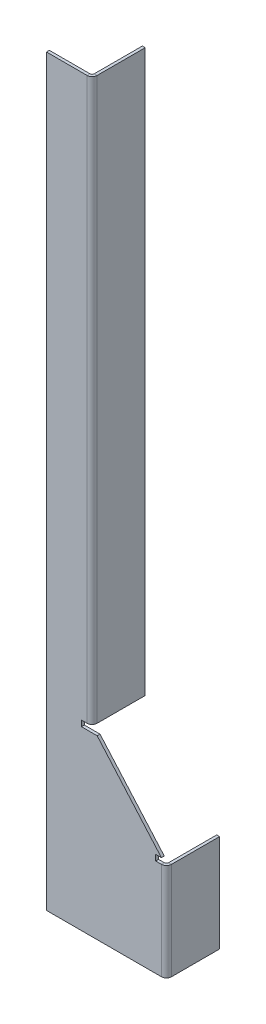
from build123d import *

# Parameters (mm, degrees)
BASE_FLANGE1_DEPTH              = 2.7
EDGE_FLANGE1_STRIP_W            = 14.8
EDGE_FLANGE1_STRIP_H            = 2.7
EDGE_FLANGE1_STRIP_CUT_DEPTH    = 91.7
EDGE_FLANGE1_RELIEF_W           = 20.2
EDGE_FLANGE1_RELIEF_H           = 5.4
EDGE_FLANGE1_RELIEF_CUT_DEPTH   = 2.7
EDGE_FLANGE1_STRIP_2_W          = 14.8
EDGE_FLANGE1_STRIP_2_H          = 2.7
EDGE_FLANGE1_STRIP_CUT_2_DEPTH  = 528.3
EDGE_FLANGE1_RELIEF_2_W         = 20.2
EDGE_FLANGE1_RELIEF_2_H         = 5.4
EDGE_FLANGE1_RELIEF_CUT_2_DEPTH = 2.7
EDGE_FLANGE1_DEPTH              = 91.7
EDGE_FLANGE1_BEND_DEPTH         = 528.3


# Sheet-metal steps are written as plain solids
with BuildPart() as part:
    # Sketch1 → Base-Flange1 (new body)
    with BuildSketch(Plane.XY):
        Polygon((43, 700), (0, 700), (0, 0), (113, 0), (113, 91.7), (43, 171.7), align=None)
    extrude(amount=-BASE_FLANGE1_DEPTH)

    # Edge-Flange1 strip (across the edge) → Edge-Flange1 strip cut (cut)
    with BuildSketch(Plane(origin=(113, 91.7, -2.7), x_dir=(-1, 0, 0), z_dir=(0, -1, 0))):
        with Locations((-2.7, -1.35)):
            Rectangle(EDGE_FLANGE1_STRIP_W, EDGE_FLANGE1_STRIP_H)
    extrude(amount=EDGE_FLANGE1_STRIP_CUT_DEPTH, mode=Mode.SUBTRACT)

    # Edge-Flange1 relief (on the sheet) → Edge-Flange1 relief cut (cut)
    with BuildSketch(Plane(origin=(108.3, 91.7, -2.7), x_dir=(-1, 0, 0), z_dir=(0, 0, -1))):
        with Locations((-4.7, 2.7)):
            Rectangle(EDGE_FLANGE1_RELIEF_W, EDGE_FLANGE1_RELIEF_H)
    extrude(amount=-EDGE_FLANGE1_RELIEF_CUT_DEPTH, mode=Mode.SUBTRACT)

    # Edge-Flange1 strip 2 (across the edge) → Edge-Flange1 strip cut 2 (cut)
    with BuildSketch(Plane(origin=(43, 700, -2.7), x_dir=(-1, 0, 0), z_dir=(0, -1, 0))):
        with Locations((-2.7, -1.35)):
            Rectangle(EDGE_FLANGE1_STRIP_2_W, EDGE_FLANGE1_STRIP_2_H)
    extrude(amount=EDGE_FLANGE1_STRIP_CUT_2_DEPTH, mode=Mode.SUBTRACT)

    # Edge-Flange1 relief 2 (on the sheet) → Edge-Flange1 relief cut 2 (cut)
    with BuildSketch(Plane(origin=(38.3, 700, -2.7), x_dir=(-1, 0, 0), z_dir=(0, 0, -1))):
        with Locations((-4.7, -531)):
            Rectangle(EDGE_FLANGE1_RELIEF_2_W, EDGE_FLANGE1_RELIEF_2_H)
    extrude(amount=-EDGE_FLANGE1_RELIEF_CUT_2_DEPTH, mode=Mode.SUBTRACT)

    # Edge-Flange1 section (across the edge) → Edge-Flange1 (add)
    with BuildSketch(Plane(origin=(113, 91.7, -2.7), x_dir=(-1, 0, 0), z_dir=(0, -1, 0))):
        with BuildLine():
            Line((0, 2), (0, 47.3))
            Line((0, 47.3), (2.7, 47.3))
            Line((2.7, 47.3), (2.7, 2))
            ThreePointArc((2.7, 2), (3.285786438, 0.585786438), (4.7, 0))
            Line((4.7, 0), (4.7, -2.7))
            ThreePointArc((4.7, -2.7), (1.376598128, -1.323401872), (0, 2))
        make_face()
    extrude(amount=EDGE_FLANGE1_DEPTH)

    # Edge-Flange1 section 2 (across the edge) → Edge-Flange1 bend (add)
    with BuildSketch(Plane(origin=(43, 700, -2.7), x_dir=(-1, 0, 0), z_dir=(0, -1, 0))):
        with BuildLine():
            Line((0, 2), (0, 47.3))
            Line((0, 47.3), (2.7, 47.3))
            Line((2.7, 47.3), (2.7, 2))
            ThreePointArc((2.7, 2), (3.285786438, 0.585786438), (4.7, 0))
            Line((4.7, 0), (4.7, -2.7))
            ThreePointArc((4.7, -2.7), (1.376598128, -1.323401872), (0, 2))
        make_face()
    extrude(amount=EDGE_FLANGE1_BEND_DEPTH)


solid = part.part
